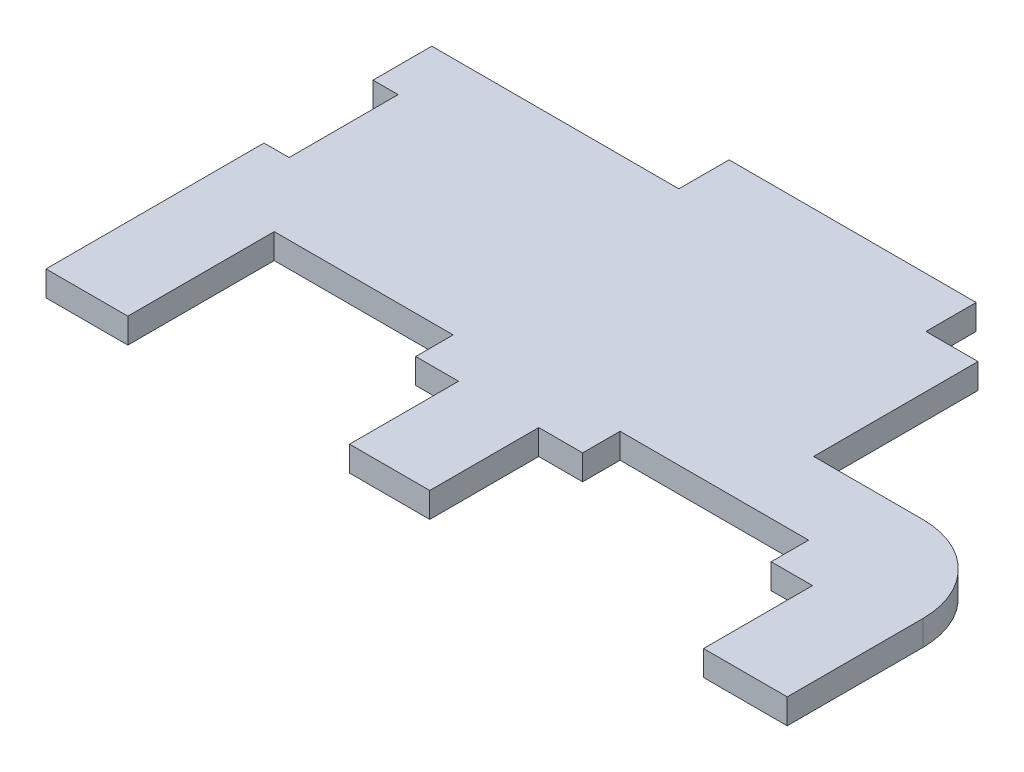
from build123d import *

# Parameters (mm, degrees)
SKETCH1_W             = 172.72
SKETCH1_H             = 76.2
BOSS_EXTRUDE1_DEPTH   = 5.85
SKETCH2_W             = 5.85
SKETCH2_H             = 25.4
SKETCH2_W_2           = 41.691074393
SKETCH2_H_2           = 8.720383817
SKETCH2_W_3           = 43.92952134
SKETCH2_W_4           = 45.443124842
SKETCH2_H_3           = 50
CUT_EXTRUDE1_DEPTH    = 10
SKETCH3_W             = 29.139699911
SKETCH3_H             = 25.4
BOSS_EXTRUDE2_DEPTH   = 5.85
SKETCH3_W_2           = 38.893015708
BOSS_EXTRUDE2_2_DEPTH = 5.85
SKETCH3_W_3           = 19.066688648
BOSS_EXTRUDE2_3_DEPTH = 5.85
SKETCH4_W             = 9.977498033
SKETCH4_H             = 25.4
SKETCH4_W_2           = 10.229966749
SKETCH4_W_3           = 9.637990001
CUT_EXTRUDE2_DEPTH    = 10
CAVITY1_START         = -38.1
CAVITY1_OUTLINE_W     = 12.130208491
CAVITY1_OUTLINE_H     = 5.85
CAVITY1_OUTLINE_W_2   = 57.573333333
CAVITY1_DEPTH         = 11.7
FILLET2_R             = 20


# Read off the part's stored shape, not the designer's step: Cavity1
with BuildPart() as part:
    # Sketch1 → Boss-Extrude1 (new body)
    with BuildSketch(Plane(origin=(0, 0, 0), x_dir=(1, 0, 0), z_dir=(0, 1, 0))):
        Rectangle(SKETCH1_W, SKETCH1_H)
    extrude(amount=BOSS_EXTRUDE1_DEPTH)

    # Sketch2 → Cut-Extrude1 (cut)
    with BuildSketch(Plane(origin=(0, 5.85, 0), x_dir=(1, 0, 0), z_dir=(0, 1, 0))):
        with Locations((-83.435, 0)):
            Rectangle(SKETCH2_W, SKETCH2_H)
        with Locations((-46.447774155, -33.739808092)):
            Rectangle(SKETCH2_W_2, SKETCH2_H_2)
        with Locations((35.255539419, -33.739808092)):
            Rectangle(SKETCH2_W_3, SKETCH2_H_2)
        with Locations((63.638437579, 13.1)):
            Rectangle(SKETCH2_W_4, SKETCH2_H_3)
    extrude(amount=-CUT_EXTRUDE1_DEPTH, mode=Mode.SUBTRACT)


with BuildPart() as body_2:
    # Sketch3 → Boss-Extrude2 (new body)
    with BuildSketch(Plane(origin=(0, 5.85, 0), x_dir=(-1, 0, 0), z_dir=(0, 1, 0))):
        with Locations((-71.790150044, 50.8)):
            Rectangle(SKETCH3_W, SKETCH3_H)
    extrude(amount=-BOSS_EXTRUDE2_DEPTH)


with BuildPart() as body_3:
    # Sketch3 → Boss-Extrude2 2 (new body)
    with BuildSketch(Plane(origin=(0, 5.85, 0), x_dir=(-1, 0, 0), z_dir=(0, 1, 0))):
        with Locations((6.155729105, 50.8)):
            Rectangle(SKETCH3_W_2, SKETCH3_H)
    extrude(amount=-BOSS_EXTRUDE2_2_DEPTH)


with BuildPart() as body_4:
    # Sketch3 → Boss-Extrude2 3 (new body)
    with BuildSketch(Plane(origin=(0, 5.85, 0), x_dir=(-1, 0, 0), z_dir=(0, 1, 0))):
        with Locations((76.826655676, 50.8)):
            Rectangle(SKETCH3_W_3, SKETCH3_H)
    extrude(amount=-BOSS_EXTRUDE2_3_DEPTH)


with BuildPart() as part_1:
    add(part.part)

    # Combine1: union body 4, body 3, body 2
    add(body_4.part)
    add(body_3.part)
    add(body_2.part)

    # Sketch4 → Cut-Extrude2 (cut)
    with BuildSketch(Plane(origin=(0, 5.85, 0), x_dir=(1, 0, 0), z_dir=(0, 1, 0))):
        with Locations((-20.613487943, -50.8)):
            Rectangle(SKETCH4_W, SKETCH4_H)
        with Locations((8.175795375, -50.8)):
            Rectangle(SKETCH4_W_2, SKETCH4_H)
        with Locations((62.03929509, -50.8)):
            Rectangle(SKETCH4_W_3, SKETCH4_H)
    extrude(amount=-CUT_EXTRUDE2_DEPTH, mode=Mode.SUBTRACT)

    # Cavity1 outline → Cavity1 (cut)
    with BuildSketch(Plane.XY.offset(CAVITY1_START)):
        with Locations((34.851770913, 2.925)):
            Rectangle(CAVITY1_OUTLINE_W, CAVITY1_OUTLINE_H)
        with Locations((-57.573333334, 2.925)):
            Rectangle(CAVITY1_OUTLINE_W_2, CAVITY1_OUTLINE_H)
    extrude(amount=CAVITY1_DEPTH, mode=Mode.SUBTRACT)

    # Fillet2
    fillet2_edges = [part_1.edges().sort_by_distance(p)[0] for p in [
        (86.36, 2.925, 11.9),
    ]]
    fillet(fillet2_edges, radius=FILLET2_R)


solid = part_1.part
